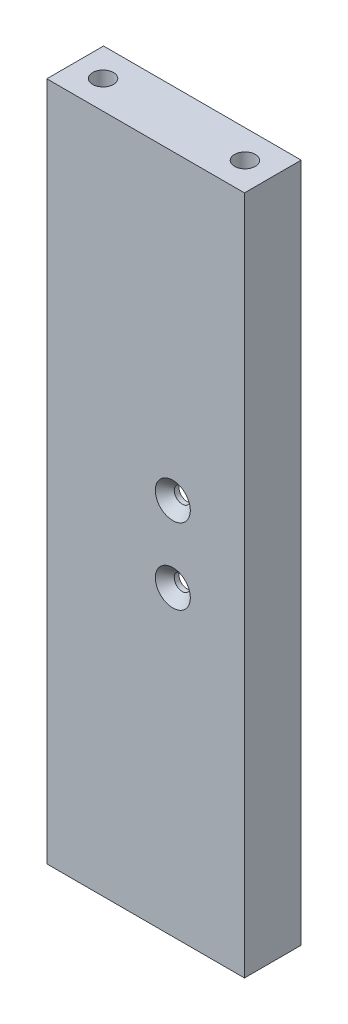
from build123d import *

# Parameters (mm, degrees)
SKETCH1_W                 = 41.8
SKETCH1_H                 = 143.8
BOSS_EXTRUDE1_DEPTH       = 12
SHELL1_T                  = -7
SHELL1_THICKNESS_2_FACE_W = 27.8
SHELL1_THICKNESS_2_FACE_H = 129.8
SHELL1_THICKNESS_2_DEPTH  = 4
SKETCH2_R                 = 2.2
CUT_EXTRUDE1_DEPTH        = 5.2
SKETCH3_R                 = 2.2
CUT_EXTRUDE2_DEPTH        = 5.2
SKETCH5_R                 = 1.7
CUT_EXTRUDE3_DEPTH        = 10
CHAMFER1_SIZE             = 2


with BuildPart() as part:
    # Sketch1 → Boss-Extrude1 (new body)
    with BuildSketch(Plane.XY):
        with Locations((0, 71.9)):
            Rectangle(SKETCH1_W, SKETCH1_H)
    extrude(amount=-BOSS_EXTRUDE1_DEPTH)

    # Shell1
    shell1_openings = [part.faces().sort_by_distance(p)[0] for p in [
        (0, 71.9, -12),
    ]]
    offset(amount=SHELL1_T, openings=shell1_openings, kind=Kind.INTERSECTION)

    # Shell1 thickness 2 face (on inner face of the shell) → Shell1 thickness 2 (cut)
    with BuildSketch(Plane(origin=(0, 71.9, -7), x_dir=(1, 0, 0), z_dir=(0, 0, 1))):
        Rectangle(SHELL1_THICKNESS_2_FACE_W, SHELL1_THICKNESS_2_FACE_H)
    extrude(amount=SHELL1_THICKNESS_2_DEPTH, mode=Mode.SUBTRACT)

    # Sketch2 → Cut-Extrude1 (cut)
    with BuildSketch(Plane(origin=(0, 143.8, 0), x_dir=(1, 0, 0), z_dir=(0, 1, 0))):
        with Locations((-15, 6)):
            Circle(SKETCH2_R)
        with Locations((15, 6)):
            Circle(SKETCH2_R)
    cut_extrude1 = extrude(amount=-CUT_EXTRUDE1_DEPTH, mode=Mode.SUBTRACT)

    # Mirror1: Cut-Extrude1 across plane
    add(cut_extrude1.mirror(Plane.ZX.offset(71.9)), mode=Mode.SUBTRACT)

    # Sketch3 → Cut-Extrude2 (cut)
    with BuildSketch(Plane.ZY.offset(20.9)):
        with Locations((-6, 129.4)):
            Circle(SKETCH3_R)
        with Locations((-6, 14.4)):
            Circle(SKETCH3_R)
    extrude(amount=-CUT_EXTRUDE2_DEPTH, mode=Mode.SUBTRACT)

    # Sketch5 → Cut-Extrude3 (cut)
    with BuildSketch(Plane(origin=(0, 0, -3), x_dir=(-1, 0, 0), z_dir=(0, 0, -1))):
        with Locations((-5.75, 63.9)):
            Circle(SKETCH5_R)
        with Locations((-5.75, 79.9)):
            Circle(SKETCH5_R)
    extrude(amount=-CUT_EXTRUDE3_DEPTH, mode=Mode.SUBTRACT)

    # Chamfer1
    chamfer1_edges = [part.edges().sort_by_distance(p)[0] for p in [
        (7.45, 63.9, 0),
        (7.45, 79.9, 0),
    ]]
    chamfer(chamfer1_edges, length=CHAMFER1_SIZE)


solid = part.part
